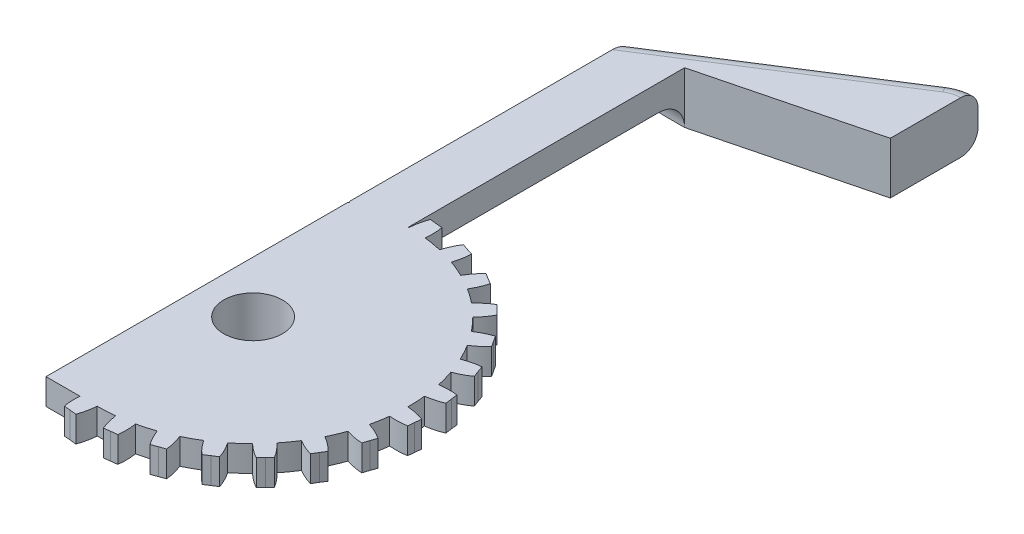
from build123d import *

# Parameters (mm, degrees)
EXTRUDE_1_DEPTH         = 3
CUT_EXTRUDE_2_REACH     = 36.142
SKETCH_2_R              = 1.7
CUT_EXTRUDE_3_OUTLINE_R = 1.7
CUT_EXTRUDE_3_DEPTH     = 1.5
EXTRUDE_2_DEPTH         = 1.5
CUT_EXTRUDE_4_REACH     = 36.142
SKETCH_5_R              = 1.7
FILLET_1_R              = 1.5
FILLET_2_R              = 1


# Read off the part's stored shape, not the designer's step: 凸台-拉伸1, 切除-拉伸3
# Some blends are built 0.0001 mm under size
with BuildPart() as part:
    # 凸台-拉伸1 outline → 凸台-拉伸1 (new body)
    with BuildSketch(Plane(origin=(0, 0, 0), x_dir=(1, 0, 0), z_dir=(0, 1, 0))):
        with BuildLine():
            add(Edge.make_bspline(
                [(-2.951006403, 8.502444426), (-2.974626432, 8.564845992), (-3, 8.626302056)],
                knots=[4.71238898, 4.71238898, 4.71238898, 4.801293402, 4.801293402, 4.801293402], degree=2, weights=[1, 0.999012163, 1]))
            ThreePointArc((-2.951006403, 8.502444426), (-2.975515576, 8.493898225), (-3, 8.485281374))
            Line((-3, 8.485281374), (-3, -8.485281374))
            ThreePointArc((-3, -8.485281374), (-2.996999027, -8.486341781), (-2.99399768, -8.487401127))
            add(Edge.make_bspline(
                [(-2.99399768, -8.487401127), (-2.997019554, -8.49679123), (-3, -8.506193769)],
                knots=[4.71238898, 4.71238898, 4.71238898, 4.725541281, 4.725541281, 4.725541281], degree=2, weights=[1, 0.999978377, 1]))
            Line((-3, -8.506193769), (-3, -9))
            Line((-3, -9), (-1.035071987, -9))
            add(Edge.make_bspline(
                [(-1.035071987, -9), (-1.074772044, -9.537341458), (-0.990305733, -9.948110306)],
                knots=[4.751971854, 4.751971854, 4.751971854, 5.442116637, 5.442116637, 5.442116637], degree=2, weights=[1, 0.941050968, 1]))
            Line((-0.990305733, -9.948110306), (-0.61903559, -9.980473393))
            Line((-0.61903559, -9.980473393), (-0.251620953, -10.022512547))
            add(Edge.make_bspline(
                [(-0.251620953, -10.022512547), (-0.079888431, -9.594624257), (-0.031754604, -8.99994398)],
                knots=[0.832111364, 0.832111364, 0.832111364, 1.589346962, 1.589346962, 1.589346962], degree=2, weights=[1, 0.929176435, 1]))
            ThreePointArc((-0.031754604, -8.99994398), (0.477410486, -8.987328815), (0.985046636, -8.945931093))
            add(Edge.make_bspline(
                [(0.985046636, -8.945931093), (1.063551131, -9.513476351), (1.248186095, -9.919054167)],
                knots=[4.71238898, 4.71238898, 4.71238898, 5.442116637, 5.442116637, 5.442116637], degree=2, weights=[1, 0.934172359, 1]))
            Line((1.248186095, -9.919054167), (1.617349186, -9.867990465))
            Line((1.617349186, -9.867990465), (1.984906562, -9.827218162))
            add(Edge.make_bspline(
                [(1.984906562, -9.827218162), (2.05711929, -9.371843844), (1.97171749, -8.781362658)],
                knots=[0.832111364, 0.832111364, 0.832111364, 1.589346962, 1.589346962, 1.589346962], degree=2, weights=[1, 0.929176435, 1]))
            ThreePointArc((1.97171749, -8.781362658), (2.465309611, -8.65576389), (2.951006403, -8.502444426))
            add(Edge.make_bspline(
                [(2.951006403, -8.502444426), (3.153833327, -9.038291246), (3.424088661, -9.392615235)],
                knots=[4.71238898, 4.71238898, 4.71238898, 5.442116637, 5.442116637, 5.442116637], degree=2, weights=[1, 0.934172359, 1]))
            Line((3.424088661, -9.392615235), (3.77263332, -9.260685291))
            Line((3.77263332, -9.260685291), (4.121902574, -9.139146023))
            add(Edge.make_bspline(
                [(4.121902574, -9.139146023), (4.090974459, -8.679120046), (3.876319437, -8.122447145)],
                knots=[0.832111364, 0.832111364, 0.832111364, 1.589346962, 1.589346962, 1.589346962], degree=2, weights=[1, 0.929176435, 1]))
            ThreePointArc((3.876319437, -8.122447145), (4.329587817, -7.890162821), (4.768990385, -7.632609692))
            add(Edge.make_bspline(
                [(4.768990385, -7.632609692), (5.08596915, -8.109888477), (5.428293124, -8.395191354)],
                knots=[4.71238898, 4.71238898, 4.71238898, 5.442116637, 5.442116637, 5.442116637], degree=2, weights=[1, 0.934172359, 1]))
            Line((5.428293124, -8.395191354), (5.738741866, -8.189010686))
            Line((5.738741866, -8.189010686), (6.052209179, -7.992798941))
            add(Edge.make_bspline(
                [(6.052209179, -7.992798941), (5.919691087, -7.551188929), (5.58654654, -7.056238216)],
                knots=[0.832111364, 0.832111364, 0.832111364, 1.589346962, 1.589346962, 1.589346962], degree=2, weights=[1, 0.929176435, 1]))
            ThreePointArc((5.58654654, -7.056238216), (5.976762411, -6.728916041), (6.347837277, -6.380044037))
            add(Edge.make_bspline(
                [(6.347837277, -6.380044037), (6.763073243, -6.774822035), (7.160300303, -6.976797523)],
                knots=[4.71238898, 4.71238898, 4.71238898, 5.442116637, 5.442116637, 5.442116637], degree=2, weights=[1, 0.934172359, 1]))
            Line((7.160300303, -6.976797523), (7.417085932, -6.706704891))
            Line((7.417085932, -6.706704891), (7.679032745, -6.445659545))
            add(Edge.make_bspline(
                [(7.679032745, -6.445659545), (7.451569685, -6.044609668), (7.016640873, -5.636200038)],
                knots=[0.832111364, 0.832111364, 0.832111364, 1.589346962, 1.589346962, 1.589346962], degree=2, weights=[1, 0.929176435, 1]))
            ThreePointArc((7.016640873, -5.636200038), (7.324237181, -5.230253313), (7.608377101, -4.807556333))
            add(Edge.make_bspline(
                [(7.608377101, -4.807556333), (8.101048603, -5.100037728), (8.533260126, -5.208557932)],
                knots=[4.71238898, 4.71238898, 4.71238898, 5.442116637, 5.442116637, 5.442116637], degree=2, weights=[1, 0.934172359, 1]))
            Line((8.533260126, -5.208557932), (8.723506338, -4.888096908))
            Line((8.723506338, -4.888096908), (8.920797543, -4.575307865))
            add(Edge.make_bspline(
                [(8.920797543, -4.575307865), (8.609795464, -4.234928437), (8.094891533, -3.933539255)],
                knots=[0.832111364, 0.832111364, 0.832111364, 1.589346962, 1.589346962, 1.589346962], degree=2, weights=[1, 0.929176435, 1]))
            ThreePointArc((8.094891533, -3.933539255), (8.304444115, -3.469323845), (8.487401127, -2.99399768))
            add(Edge.make_bspline(
                [(8.487401127, -2.99399768), (9.03280356, -3.169516233), (9.478326654, -3.179139497)],
                knots=[4.71238898, 4.71238898, 4.71238898, 5.442116637, 5.442116637, 5.442116637], degree=2, weights=[1, 0.934172359, 1]))
            Line((9.478326654, -3.179139497), (9.59249371, -2.824379336))
            Line((9.59249371, -2.824379336), (9.715236303, -2.475531143))
            add(Edge.make_bspline(
                [(9.715236303, -2.475531143), (9.336290147, -2.212890212), (8.76723053, -2.03363439)],
                knots=[0.832111364, 0.832111364, 0.832111364, 1.589346962, 1.589346962, 1.589346962], degree=2, weights=[1, 0.929176435, 1]))
            ThreePointArc((8.76723053, -2.03363439), (8.868231545, -1.534427993), (8.940831421, -1.030307481))
            add(Edge.make_bspline(
                [(8.940831421, -1.030307481), (9.511616028, -1.080061959), (9.948110306, -0.990305733)],
                knots=[4.71238898, 4.71238898, 4.71238898, 5.442116637, 5.442116637, 5.442116637], degree=2, weights=[1, 0.934172359, 1]))
            Line((9.948110306, -0.990305733), (9.980473393, -0.61903559))
            Line((9.980473393, -0.61903559), (10.022512547, -0.251620953))
            add(Edge.make_bspline(
                [(10.022512547, -0.251620953), (9.594624257, -0.079888431), (8.99994398, -0.031754604)],
                knots=[0.832111364, 0.832111364, 0.832111364, 1.589346962, 1.589346962, 1.589346962], degree=2, weights=[1, 0.929176435, 1]))
            ThreePointArc((8.99994398, -0.031754604), (8.987328815, 0.477410486), (8.945931093, 0.985046636))
            add(Edge.make_bspline(
                [(8.945931093, 0.985046636), (9.513476351, 1.063551131), (9.919054167, 1.248186095)],
                knots=[4.71238898, 4.71238898, 4.71238898, 5.442116637, 5.442116637, 5.442116637], degree=2, weights=[1, 0.934172359, 1]))
            Line((9.919054167, 1.248186095), (9.867990465, 1.617349186))
            Line((9.867990465, 1.617349186), (9.827218162, 1.984906562))
            add(Edge.make_bspline(
                [(9.827218162, 1.984906562), (9.371843844, 2.05711929), (8.781362658, 1.97171749)],
                knots=[0.832111364, 0.832111364, 0.832111364, 1.589346962, 1.589346962, 1.589346962], degree=2, weights=[1, 0.929176435, 1]))
            ThreePointArc((8.781362658, 1.97171749), (8.65576389, 2.465309611), (8.502444426, 2.951006403))
            add(Edge.make_bspline(
                [(8.502444426, 2.951006403), (9.038291246, 3.153833327), (9.392615235, 3.424088661)],
                knots=[4.71238898, 4.71238898, 4.71238898, 5.442116637, 5.442116637, 5.442116637], degree=2, weights=[1, 0.934172359, 1]))
            Line((9.392615235, 3.424088661), (9.260685291, 3.77263332))
            Line((9.260685291, 3.77263332), (9.139146023, 4.121902574))
            add(Edge.make_bspline(
                [(9.139146023, 4.121902574), (8.679120046, 4.090974459), (8.122447145, 3.876319437)],
                knots=[0.832111364, 0.832111364, 0.832111364, 1.589346962, 1.589346962, 1.589346962], degree=2, weights=[1, 0.929176435, 1]))
            ThreePointArc((8.122447145, 3.876319437), (7.890162821, 4.329587817), (7.632609692, 4.768990385))
            add(Edge.make_bspline(
                [(7.632609692, 4.768990385), (8.109888477, 5.08596915), (8.395191354, 5.428293124)],
                knots=[4.71238898, 4.71238898, 4.71238898, 5.442116637, 5.442116637, 5.442116637], degree=2, weights=[1, 0.934172359, 1]))
            Line((8.395191354, 5.428293124), (8.189010686, 5.738741866))
            Line((8.189010686, 5.738741866), (7.992798941, 6.052209179))
            add(Edge.make_bspline(
                [(7.992798941, 6.052209179), (7.551188929, 5.919691087), (7.056238216, 5.58654654)],
                knots=[0.832111364, 0.832111364, 0.832111364, 1.589346962, 1.589346962, 1.589346962], degree=2, weights=[1, 0.929176435, 1]))
            ThreePointArc((7.056238216, 5.58654654), (6.728916041, 5.976762411), (6.380044037, 6.347837277))
            add(Edge.make_bspline(
                [(6.380044037, 6.347837277), (6.774822035, 6.763073243), (6.976797523, 7.160300303)],
                knots=[4.71238898, 4.71238898, 4.71238898, 5.442116637, 5.442116637, 5.442116637], degree=2, weights=[1, 0.934172359, 1]))
            Line((6.976797523, 7.160300303), (6.706704891, 7.417085932))
            Line((6.706704891, 7.417085932), (6.445659545, 7.679032745))
            add(Edge.make_bspline(
                [(6.445659545, 7.679032745), (6.044609668, 7.451569685), (5.636200038, 7.016640873)],
                knots=[0.832111364, 0.832111364, 0.832111364, 1.589346962, 1.589346962, 1.589346962], degree=2, weights=[1, 0.929176435, 1]))
            ThreePointArc((5.636200038, 7.016640873), (5.230253313, 7.324237181), (4.807556333, 7.608377101))
            add(Edge.make_bspline(
                [(4.807556333, 7.608377101), (5.100037728, 8.101048603), (5.208557932, 8.533260126)],
                knots=[4.71238898, 4.71238898, 4.71238898, 5.442116637, 5.442116637, 5.442116637], degree=2, weights=[1, 0.934172359, 1]))
            Line((5.208557932, 8.533260126), (4.888096908, 8.723506338))
            Line((4.888096908, 8.723506338), (4.575307865, 8.920797543))
            add(Edge.make_bspline(
                [(4.575307865, 8.920797543), (4.234928437, 8.609795464), (3.933539255, 8.094891533)],
                knots=[0.832111364, 0.832111364, 0.832111364, 1.589346962, 1.589346962, 1.589346962], degree=2, weights=[1, 0.929176435, 1]))
            ThreePointArc((3.933539255, 8.094891533), (3.469323845, 8.304444115), (2.99399768, 8.487401127))
            add(Edge.make_bspline(
                [(2.99399768, 8.487401127), (3.169516233, 9.03280356), (3.179139497, 9.478326654)],
                knots=[4.71238898, 4.71238898, 4.71238898, 5.442116637, 5.442116637, 5.442116637], degree=2, weights=[1, 0.934172359, 1]))
            Line((3.179139497, 9.478326654), (2.824379336, 9.59249371))
            Line((2.824379336, 9.59249371), (2.475531143, 9.715236303))
            add(Edge.make_bspline(
                [(2.475531143, 9.715236303), (2.212890212, 9.336290147), (2.03363439, 8.76723053)],
                knots=[0.832111364, 0.832111364, 0.832111364, 1.589346962, 1.589346962, 1.589346962], degree=2, weights=[1, 0.929176435, 1]))
            ThreePointArc((2.03363439, 8.76723053), (1.534427993, 8.868231545), (1.030307481, 8.940831421))
            add(Edge.make_bspline(
                [(1.030307481, 8.940831421), (1.080061959, 9.511616028), (0.990305733, 9.948110306)],
                knots=[4.71238898, 4.71238898, 4.71238898, 5.442116637, 5.442116637, 5.442116637], degree=2, weights=[1, 0.934172359, 1]))
            Line((0.990305733, 9.948110306), (0.61903559, 9.980473393))
            Line((0.61903559, 9.980473393), (0.251620953, 10.022512547))
            add(Edge.make_bspline(
                [(0.251620953, 10.022512547), (0.079888431, 9.594624257), (0.031754604, 8.99994398)],
                knots=[0.832111364, 0.832111364, 0.832111364, 1.589346962, 1.589346962, 1.589346962], degree=2, weights=[1, 0.929176435, 1]))
            ThreePointArc((0.031754604, 8.99994398), (0.015877327, 8.999985995), (0, 9))
            Line((0, 9), (0, 25))
            Line((0, 25), (9.5, 27.420151434))
            Line((9.5, 27.420151434), (9.5, 32.5))
            ThreePointArc((9.5, 32.5), (8.800362864, 32.400105806), (8.156637479, 32.108406303))
            Line((8.156637479, 32.108406303), (-3, 25))
            Line((-3, 25), (-3, 8.626302056))
        make_face()
    extrude(amount=EXTRUDE_1_DEPTH)

    # 草图2 → 切除-拉伸2 (cut, up to next)
    with BuildSketch(Plane.XZ, mode=Mode.PRIVATE) as cut_extrude_2_sk1:
        with Locations(Location((0, 0, 0), (0, 0, 270))):
            Circle(SKETCH_2_R)
    cut_extrude_2_tool1 = extrude(cut_extrude_2_sk1.sketch, amount=-CUT_EXTRUDE_2_REACH, mode=Mode.PRIVATE) & part.part
    add(cut_extrude_2_tool1.solids().sort_by_distance((0, 0, 0))[0], mode=Mode.SUBTRACT)

    # 切除-拉伸3 outline → 切除-拉伸3 (cut)
    with BuildSketch(Plane(origin=(0, 0, 0), x_dir=(1, 0, 0), z_dir=(0, 1, 0))):
        with BuildLine():
            Line((0, 9), (0, 25))
            Line((0, 25), (-3, 25))
            Line((-3, 25), (-3, 8.626302056))
            add(Edge.make_bspline(
                [(-2.951006403, 8.502444426), (-2.974626432, 8.564845992), (-3, 8.626302056)],
                knots=[4.71238898, 4.71238898, 4.71238898, 4.801293402, 4.801293402, 4.801293402], degree=2, weights=[1, 0.999012163, 1]))
            ThreePointArc((-2.951006403, 8.502444426), (-2.975515576, 8.493898225), (-3, 8.485281374))
            Line((-3, 8.485281374), (-3, -8.485281374))
            ThreePointArc((-3, -8.485281374), (-2.996999027, -8.486341781), (-2.99399768, -8.487401127))
            add(Edge.make_bspline(
                [(-2.99399768, -8.487401127), (-2.997019554, -8.49679123), (-3, -8.506193769)],
                knots=[4.71238898, 4.71238898, 4.71238898, 4.725541281, 4.725541281, 4.725541281], degree=2, weights=[1, 0.999978377, 1]))
            Line((-3, -8.506193769), (-3, -9))
            Line((-3, -9), (-1.035071987, -9))
            add(Edge.make_bspline(
                [(-1.035071987, -9), (-1.074772044, -9.537341458), (-0.990305733, -9.948110306)],
                knots=[4.751971854, 4.751971854, 4.751971854, 5.442116637, 5.442116637, 5.442116637], degree=2, weights=[1, 0.941050968, 1]))
            Line((-0.990305733, -9.948110306), (-0.61903559, -9.980473393))
            Line((-0.61903559, -9.980473393), (-0.251620953, -10.022512547))
            add(Edge.make_bspline(
                [(-0.251620953, -10.022512547), (-0.079888431, -9.594624257), (-0.031754604, -8.99994398)],
                knots=[0.832111364, 0.832111364, 0.832111364, 1.589346962, 1.589346962, 1.589346962], degree=2, weights=[1, 0.929176435, 1]))
            ThreePointArc((-0.031754604, -8.99994398), (0.477410486, -8.987328815), (0.985046636, -8.945931093))
            add(Edge.make_bspline(
                [(0.985046636, -8.945931093), (1.063551131, -9.513476351), (1.248186095, -9.919054167)],
                knots=[4.71238898, 4.71238898, 4.71238898, 5.442116637, 5.442116637, 5.442116637], degree=2, weights=[1, 0.934172359, 1]))
            Line((1.248186095, -9.919054167), (1.617349186, -9.867990465))
            Line((1.617349186, -9.867990465), (1.984906562, -9.827218162))
            add(Edge.make_bspline(
                [(1.984906562, -9.827218162), (2.05711929, -9.371843844), (1.97171749, -8.781362658)],
                knots=[0.832111364, 0.832111364, 0.832111364, 1.589346962, 1.589346962, 1.589346962], degree=2, weights=[1, 0.929176435, 1]))
            ThreePointArc((1.97171749, -8.781362658), (2.465309611, -8.65576389), (2.951006403, -8.502444426))
            add(Edge.make_bspline(
                [(2.951006403, -8.502444426), (3.153833327, -9.038291246), (3.424088661, -9.392615235)],
                knots=[4.71238898, 4.71238898, 4.71238898, 5.442116637, 5.442116637, 5.442116637], degree=2, weights=[1, 0.934172359, 1]))
            Line((3.424088661, -9.392615235), (3.77263332, -9.260685291))
            Line((3.77263332, -9.260685291), (4.121902574, -9.139146023))
            add(Edge.make_bspline(
                [(4.121902574, -9.139146023), (4.090974459, -8.679120046), (3.876319437, -8.122447145)],
                knots=[0.832111364, 0.832111364, 0.832111364, 1.589346962, 1.589346962, 1.589346962], degree=2, weights=[1, 0.929176435, 1]))
            ThreePointArc((3.876319437, -8.122447145), (4.329587817, -7.890162821), (4.768990385, -7.632609692))
            add(Edge.make_bspline(
                [(4.768990385, -7.632609692), (5.08596915, -8.109888477), (5.428293124, -8.395191354)],
                knots=[4.71238898, 4.71238898, 4.71238898, 5.442116637, 5.442116637, 5.442116637], degree=2, weights=[1, 0.934172359, 1]))
            Line((5.428293124, -8.395191354), (5.738741866, -8.189010686))
            Line((5.738741866, -8.189010686), (6.052209179, -7.992798941))
            add(Edge.make_bspline(
                [(6.052209179, -7.992798941), (5.919691087, -7.551188929), (5.58654654, -7.056238216)],
                knots=[0.832111364, 0.832111364, 0.832111364, 1.589346962, 1.589346962, 1.589346962], degree=2, weights=[1, 0.929176435, 1]))
            ThreePointArc((5.58654654, -7.056238216), (5.976762411, -6.728916041), (6.347837277, -6.380044037))
            add(Edge.make_bspline(
                [(6.347837277, -6.380044037), (6.763073243, -6.774822035), (7.160300303, -6.976797523)],
                knots=[4.71238898, 4.71238898, 4.71238898, 5.442116637, 5.442116637, 5.442116637], degree=2, weights=[1, 0.934172359, 1]))
            Line((7.160300303, -6.976797523), (7.417085932, -6.706704891))
            Line((7.417085932, -6.706704891), (7.679032745, -6.445659545))
            add(Edge.make_bspline(
                [(7.679032745, -6.445659545), (7.451569685, -6.044609668), (7.016640873, -5.636200038)],
                knots=[0.832111364, 0.832111364, 0.832111364, 1.589346962, 1.589346962, 1.589346962], degree=2, weights=[1, 0.929176435, 1]))
            ThreePointArc((7.016640873, -5.636200038), (7.324237181, -5.230253313), (7.608377101, -4.807556333))
            add(Edge.make_bspline(
                [(7.608377101, -4.807556333), (8.101048603, -5.100037728), (8.533260126, -5.208557932)],
                knots=[4.71238898, 4.71238898, 4.71238898, 5.442116637, 5.442116637, 5.442116637], degree=2, weights=[1, 0.934172359, 1]))
            Line((8.533260126, -5.208557932), (8.723506338, -4.888096908))
            Line((8.723506338, -4.888096908), (8.920797543, -4.575307865))
            add(Edge.make_bspline(
                [(8.920797543, -4.575307865), (8.609795464, -4.234928437), (8.094891533, -3.933539255)],
                knots=[0.832111364, 0.832111364, 0.832111364, 1.589346962, 1.589346962, 1.589346962], degree=2, weights=[1, 0.929176435, 1]))
            ThreePointArc((8.094891533, -3.933539255), (8.304444115, -3.469323845), (8.487401127, -2.99399768))
            add(Edge.make_bspline(
                [(8.487401127, -2.99399768), (9.03280356, -3.169516233), (9.478326654, -3.179139497)],
                knots=[4.71238898, 4.71238898, 4.71238898, 5.442116637, 5.442116637, 5.442116637], degree=2, weights=[1, 0.934172359, 1]))
            Line((9.478326654, -3.179139497), (9.59249371, -2.824379336))
            Line((9.59249371, -2.824379336), (9.715236303, -2.475531143))
            add(Edge.make_bspline(
                [(9.715236303, -2.475531143), (9.336290147, -2.212890212), (8.76723053, -2.03363439)],
                knots=[0.832111364, 0.832111364, 0.832111364, 1.589346962, 1.589346962, 1.589346962], degree=2, weights=[1, 0.929176435, 1]))
            ThreePointArc((8.76723053, -2.03363439), (8.868231545, -1.534427993), (8.940831421, -1.030307481))
            add(Edge.make_bspline(
                [(8.940831421, -1.030307481), (9.511616028, -1.080061959), (9.948110306, -0.990305733)],
                knots=[4.71238898, 4.71238898, 4.71238898, 5.442116637, 5.442116637, 5.442116637], degree=2, weights=[1, 0.934172359, 1]))
            Line((9.948110306, -0.990305733), (9.980473393, -0.61903559))
            Line((9.980473393, -0.61903559), (10.022512547, -0.251620953))
            add(Edge.make_bspline(
                [(10.022512547, -0.251620953), (9.594624257, -0.079888431), (8.99994398, -0.031754604)],
                knots=[0.832111364, 0.832111364, 0.832111364, 1.589346962, 1.589346962, 1.589346962], degree=2, weights=[1, 0.929176435, 1]))
            ThreePointArc((8.99994398, -0.031754604), (8.987328815, 0.477410486), (8.945931093, 0.985046636))
            add(Edge.make_bspline(
                [(8.945931093, 0.985046636), (9.513476351, 1.063551131), (9.919054167, 1.248186095)],
                knots=[4.71238898, 4.71238898, 4.71238898, 5.442116637, 5.442116637, 5.442116637], degree=2, weights=[1, 0.934172359, 1]))
            Line((9.919054167, 1.248186095), (9.867990465, 1.617349186))
            Line((9.867990465, 1.617349186), (9.827218162, 1.984906562))
            add(Edge.make_bspline(
                [(9.827218162, 1.984906562), (9.371843844, 2.05711929), (8.781362658, 1.97171749)],
                knots=[0.832111364, 0.832111364, 0.832111364, 1.589346962, 1.589346962, 1.589346962], degree=2, weights=[1, 0.929176435, 1]))
            ThreePointArc((8.781362658, 1.97171749), (8.65576389, 2.465309611), (8.502444426, 2.951006403))
            add(Edge.make_bspline(
                [(8.502444426, 2.951006403), (9.038291246, 3.153833327), (9.392615235, 3.424088661)],
                knots=[4.71238898, 4.71238898, 4.71238898, 5.442116637, 5.442116637, 5.442116637], degree=2, weights=[1, 0.934172359, 1]))
            Line((9.392615235, 3.424088661), (9.260685291, 3.77263332))
            Line((9.260685291, 3.77263332), (9.139146023, 4.121902574))
            add(Edge.make_bspline(
                [(9.139146023, 4.121902574), (8.679120046, 4.090974459), (8.122447145, 3.876319437)],
                knots=[0.832111364, 0.832111364, 0.832111364, 1.589346962, 1.589346962, 1.589346962], degree=2, weights=[1, 0.929176435, 1]))
            ThreePointArc((8.122447145, 3.876319437), (7.890162821, 4.329587817), (7.632609692, 4.768990385))
            add(Edge.make_bspline(
                [(7.632609692, 4.768990385), (8.109888477, 5.08596915), (8.395191354, 5.428293124)],
                knots=[4.71238898, 4.71238898, 4.71238898, 5.442116637, 5.442116637, 5.442116637], degree=2, weights=[1, 0.934172359, 1]))
            Line((8.395191354, 5.428293124), (8.189010686, 5.738741866))
            Line((8.189010686, 5.738741866), (7.992798941, 6.052209179))
            add(Edge.make_bspline(
                [(7.992798941, 6.052209179), (7.551188929, 5.919691087), (7.056238216, 5.58654654)],
                knots=[0.832111364, 0.832111364, 0.832111364, 1.589346962, 1.589346962, 1.589346962], degree=2, weights=[1, 0.929176435, 1]))
            ThreePointArc((7.056238216, 5.58654654), (6.728916041, 5.976762411), (6.380044037, 6.347837277))
            add(Edge.make_bspline(
                [(6.380044037, 6.347837277), (6.774822035, 6.763073243), (6.976797523, 7.160300303)],
                knots=[4.71238898, 4.71238898, 4.71238898, 5.442116637, 5.442116637, 5.442116637], degree=2, weights=[1, 0.934172359, 1]))
            Line((6.976797523, 7.160300303), (6.706704891, 7.417085932))
            Line((6.706704891, 7.417085932), (6.445659545, 7.679032745))
            add(Edge.make_bspline(
                [(6.445659545, 7.679032745), (6.044609668, 7.451569685), (5.636200038, 7.016640873)],
                knots=[0.832111364, 0.832111364, 0.832111364, 1.589346962, 1.589346962, 1.589346962], degree=2, weights=[1, 0.929176435, 1]))
            ThreePointArc((5.636200038, 7.016640873), (5.230253313, 7.324237181), (4.807556333, 7.608377101))
            add(Edge.make_bspline(
                [(4.807556333, 7.608377101), (5.100037728, 8.101048603), (5.208557932, 8.533260126)],
                knots=[4.71238898, 4.71238898, 4.71238898, 5.442116637, 5.442116637, 5.442116637], degree=2, weights=[1, 0.934172359, 1]))
            Line((5.208557932, 8.533260126), (4.888096908, 8.723506338))
            Line((4.888096908, 8.723506338), (4.575307865, 8.920797543))
            add(Edge.make_bspline(
                [(4.575307865, 8.920797543), (4.234928437, 8.609795464), (3.933539255, 8.094891533)],
                knots=[0.832111364, 0.832111364, 0.832111364, 1.589346962, 1.589346962, 1.589346962], degree=2, weights=[1, 0.929176435, 1]))
            ThreePointArc((3.933539255, 8.094891533), (3.469323845, 8.304444115), (2.99399768, 8.487401127))
            add(Edge.make_bspline(
                [(2.99399768, 8.487401127), (3.169516233, 9.03280356), (3.179139497, 9.478326654)],
                knots=[4.71238898, 4.71238898, 4.71238898, 5.442116637, 5.442116637, 5.442116637], degree=2, weights=[1, 0.934172359, 1]))
            Line((3.179139497, 9.478326654), (2.824379336, 9.59249371))
            Line((2.824379336, 9.59249371), (2.475531143, 9.715236303))
            add(Edge.make_bspline(
                [(2.475531143, 9.715236303), (2.212890212, 9.336290147), (2.03363439, 8.76723053)],
                knots=[0.832111364, 0.832111364, 0.832111364, 1.589346962, 1.589346962, 1.589346962], degree=2, weights=[1, 0.929176435, 1]))
            ThreePointArc((2.03363439, 8.76723053), (1.534427993, 8.868231545), (1.030307481, 8.940831421))
            add(Edge.make_bspline(
                [(1.030307481, 8.940831421), (1.080061959, 9.511616028), (0.990305733, 9.948110306)],
                knots=[4.71238898, 4.71238898, 4.71238898, 5.442116637, 5.442116637, 5.442116637], degree=2, weights=[1, 0.934172359, 1]))
            Line((0.990305733, 9.948110306), (0.61903559, 9.980473393))
            Line((0.61903559, 9.980473393), (0.251620953, 10.022512547))
            add(Edge.make_bspline(
                [(0.251620953, 10.022512547), (0.079888431, 9.594624257), (0.031754604, 8.99994398)],
                knots=[0.832111364, 0.832111364, 0.832111364, 1.589346962, 1.589346962, 1.589346962], degree=2, weights=[1, 0.929176435, 1]))
            ThreePointArc((0.031754604, 8.99994398), (0.015877327, 8.999985995), (0, 9))
        make_face()
        Circle(CUT_EXTRUDE_3_OUTLINE_R, mode=Mode.SUBTRACT)
    extrude(amount=CUT_EXTRUDE_3_DEPTH, mode=Mode.SUBTRACT)

    # 草图4 → 凸台-拉伸2 (add)
    with BuildSketch(Plane.XZ.offset(-1.5)):
        with BuildLine():
            Line((2.536808817, -3.115042522), (3.068604617, -2.59278896))
            add(Edge.make_bspline(
                [(3.068604617, -2.59278896), (2.851436007, -2.182278397), (2.429252785, -1.760321251)],
                knots=[0.841068671, 0.841068671, 0.841068671, 1.598751363, 1.598751363, 1.598751363], degree=2, weights=[1, 0.92909378, 1]))
            ThreePointArc((2.429252785, -1.760321251), (2.660580713, -1.386113367), (2.834693105, -0.982097247))
            add(Edge.make_bspline(
                [(2.834693105, -0.982097247), (3.422426696, -1.086288091), (3.883297499, -1.029023528)],
                knots=[4.684433944, 4.684433944, 4.684433944, 5.442116637, 5.442116637, 5.442116637], degree=2, weights=[1, 0.92909378, 1]))
            Line((3.883297499, -1.029023528), (4.006556397, -0.293929792))
            add(Edge.make_bspline(
                [(4.006556397, -0.293929792), (3.589571246, -0.089468277), (2.999997657, 0.003749153)],
                knots=[0.841068671, 0.841068671, 0.841068671, 1.598751363, 1.598751363, 1.598751363], degree=2, weights=[1, 0.92909378, 1]))
            ThreePointArc((2.999997657, 0.003749153), (2.967192007, 0.442460835), (2.870577173, 0.871657439))
            add(Edge.make_bspline(
                [(2.870577173, 0.871657439), (3.407305478, 1.132826413), (3.746498525, 1.450047479)],
                knots=[4.684433944, 4.684433944, 4.684433944, 5.442116637, 5.442116637, 5.442116637], degree=2, weights=[1, 0.92909378, 1]))
            Line((3.746498525, 1.450047479), (3.414139812, 2.117200566))
            add(Edge.make_bspline(
                [(3.414139812, 2.117200566), (2.956612275, 2.037515684), (2.424845391, 1.766387509)],
                knots=[0.841068671, 0.841068671, 0.841068671, 1.598751363, 1.598751363, 1.598751363], degree=2, weights=[1, 0.92909378, 1]))
            ThreePointArc((2.424845391, 1.766387509), (2.140436806, 2.102030038), (1.809998329, 2.39246861))
            add(Edge.make_bspline(
                [(1.809998329, 2.39246861), (2.090709378, 2.91923973), (2.178664453, 3.375249634)],
                knots=[4.684433944, 4.684433944, 4.684433944, 5.442116637, 5.442116637, 5.442116637], degree=2, weights=[1, 0.92909378, 1]))
            Line((2.178664453, 3.375249634), (1.51763786, 3.719632269))
            add(Edge.make_bspline(
                [(1.51763786, 3.719632269), (1.194327905, 3.386237906), (0.923484602, 2.854325873)],
                knots=[0.841068671, 0.841068671, 0.841068671, 1.598751363, 1.598751363, 1.598751363], degree=2, weights=[1, 0.92909378, 1]))
            ThreePointArc((0.923484602, 2.854325873), (0.496107495, 2.958695211), (0.058061643, 2.999438088))
            add(Edge.make_bspline(
                [(0.058061643, 2.999438088), (-0.024466644, 3.590602691), (-0.22134539, 4.011221149)],
                knots=[4.684433944, 4.684433944, 4.684433944, 5.442116637, 5.442116637, 5.442116637], degree=2, weights=[1, 0.92909378, 1]))
            Line((-0.22134539, 4.011221149), (-0.958550171, 3.901290871))
            add(Edge.make_bspline(
                [(-0.958550171, 3.901290871), (-1.02414913, 3.441532343), (-0.930615916, 2.852008769)],
                knots=[0.841068671, 0.841068671, 0.841068671, 1.598751363, 1.598751363, 1.598751363], degree=2, weights=[1, 0.92909378, 1]))
            ThreePointArc((-0.930615916, 2.852008769), (-1.337718017, 2.685239376), (-1.716052618, 2.460724164))
            add(Edge.make_bspline(
                [(-1.716052618, 2.460724164), (-2.13029724, 2.890477465), (-2.536808817, 3.115042522)],
                knots=[4.684433944, 4.684433944, 4.684433944, 5.442116637, 5.442116637, 5.442116637], degree=2, weights=[1, 0.92909378, 1]))
            Line((-2.536808817, 3.115042522), (-3, 2.660162576))
            Line((-3, 2.660162576), (-3, 2.472095494))
            add(Edge.make_bspline(
                [(-3, 2.472095494), (-2.782639208, 2.113518438), (-2.429252785, 1.760321251)],
                knots=[0.95712303, 0.95712303, 0.95712303, 1.598751363, 1.598751363, 1.598751363], degree=2, weights=[0.981605644, 0.939954496, 1]))
            ThreePointArc((-2.429252785, 1.760321251), (-2.967192007, -0.442460835), (-1.809998329, -2.39246861))
            add(Edge.make_bspline(
                [(-1.809998329, -2.39246861), (-2.090709378, -2.91923973), (-2.178664453, -3.375249634)],
                knots=[4.684433944, 4.684433944, 4.684433944, 5.442116637, 5.442116637, 5.442116637], degree=2, weights=[1, 0.92909378, 1]))
            Line((-2.178664453, -3.375249634), (-1.51763786, -3.719632269))
            add(Edge.make_bspline(
                [(-1.51763786, -3.719632269), (-1.194327905, -3.386237906), (-0.923484602, -2.854325873)],
                knots=[0.841068671, 0.841068671, 0.841068671, 1.598751363, 1.598751363, 1.598751363], degree=2, weights=[1, 0.92909378, 1]))
            ThreePointArc((-0.923484602, -2.854325873), (-0.496107495, -2.958695211), (-0.058061643, -2.999438088))
            add(Edge.make_bspline(
                [(-0.058061643, -2.999438088), (0.024466644, -3.590602691), (0.22134539, -4.011221149)],
                knots=[1.54284129, 1.54284129, 1.54284129, 2.300523983, 2.300523983, 2.300523983], degree=2, weights=[1, 0.92909378, 1]))
            Line((0.22134539, -4.011221149), (0.958550171, -3.901290871))
            add(Edge.make_bspline(
                [(0.958550171, -3.901290871), (1.02414913, -3.441532343), (0.930615916, -2.852008769)],
                knots=[3.982661324, 3.982661324, 3.982661324, 4.740344017, 4.740344017, 4.740344017], degree=2, weights=[1, 0.92909378, 1]))
            ThreePointArc((0.930615916, -2.852008769), (1.337718017, -2.685239376), (1.716052618, -2.460724164))
            add(Edge.make_bspline(
                [(1.716052618, -2.460724164), (2.13029724, -2.890477465), (2.536808817, -3.115042522)],
                knots=[4.684433944, 4.684433944, 4.684433944, 5.442116637, 5.442116637, 5.442116637], degree=2, weights=[1, 0.92909378, 1]))
        make_face()
    extrude(amount=EXTRUDE_2_DEPTH)

    # 草图5 → 切除-拉伸4 (cut, up to next)
    with BuildSketch(Plane.XZ, mode=Mode.PRIVATE) as cut_extrude_4_sk1:
        with Locations(Location((0, 0, 0), (0, 0, 270))):
            Circle(SKETCH_5_R)
    cut_extrude_4_tool1 = extrude(cut_extrude_4_sk1.sketch, amount=-CUT_EXTRUDE_4_REACH, mode=Mode.PRIVATE) & part.part
    add(cut_extrude_4_tool1.solids().sort_by_distance((0, 0, 0))[0], mode=Mode.SUBTRACT)

    # 圆角1
    fillet_1_edges = [part.edges().sort_by_distance(p)[0] for p in [
        (-1.5, 1.5, -25),
    ]]
    fillet(fillet_1_edges, radius=FILLET_1_R - 0.0001)  # a hair under: the kernel refuses the full size

    # 圆角2
    # the kernel refuses this fillet: 1 mm, written as the material it takes off along each edge
    with BuildSketch(Plane(origin=(9.499999998, 3, -30.000000007), x_dir=(0.8414992868215885, 0, -0.5402582255540012), z_dir=(0.5402582255540012, 0, 0.8414992868215885))) as fillet_2_piece_1:
        with BuildLine():
            CenterArc((2.499999993 - FILLET_2_R, -FILLET_2_R), FILLET_2_R, 0, 90)
            Line((2.499999993, -FILLET_2_R), (2.499999993, 0))
            Line((2.499999993, 0), (2.499999993 - FILLET_2_R, 0))
        make_face()
    revolve(axis=Axis((9.499999998, 3, -30.000000007), (0, 1, 0)), revolution_arc=89.801865227, mode=Mode.SUBTRACT)
    with BuildSketch(Plane(origin=(8.156637479, 3, -32.108406303), x_dir=(0.5373450084400123, 0, 0.8433625210457263), z_dir=(-0.8433625210457263, 0, 0.5373450084400123))) as fillet_2_piece_2:
        with BuildLine():
            CenterArc((FILLET_2_R, -FILLET_2_R), FILLET_2_R, 90, 90)
            Line((0, -FILLET_2_R), (0, 0))
            Line((0, 0), (FILLET_2_R, 0))
        make_face()
    extrude(amount=15.728756556, mode=Mode.SUBTRACT)
    with BuildSketch(Plane(origin=(8.156637479, 0, -32.108406303), x_dir=(0.5373450084400123, 0, 0.8433625210457263), z_dir=(-0.8433625210457263, 0, 0.5373450084400123))) as fillet_2_piece_3:
        with BuildLine():
            CenterArc((FILLET_2_R, FILLET_2_R), FILLET_2_R, 180, 90)
            Line((0, FILLET_2_R), (0, 0))
            Line((0, 0), (FILLET_2_R, 0))
        make_face()
    extrude(amount=15.728756556, mode=Mode.SUBTRACT)
    with BuildSketch(Plane(origin=(9.499999998, 0, -30.000000007), x_dir=(0.8414992868215885, 0, -0.5402582255540012), z_dir=(0.5402582255540012, 0, 0.8414992868215885))) as fillet_2_piece_4:
        with BuildLine():
            CenterArc((2.499999993 - FILLET_2_R, FILLET_2_R), FILLET_2_R, 270, 90)
            Line((2.499999993, FILLET_2_R), (2.499999993, 0))
            Line((2.499999993, 0), (2.499999993 - FILLET_2_R, 0))
        make_face()
    revolve(axis=Axis((9.499999998, 0, -30.000000007), (0, 1, 0)), revolution_arc=89.801865227, mode=Mode.SUBTRACT)


solid = part.part
